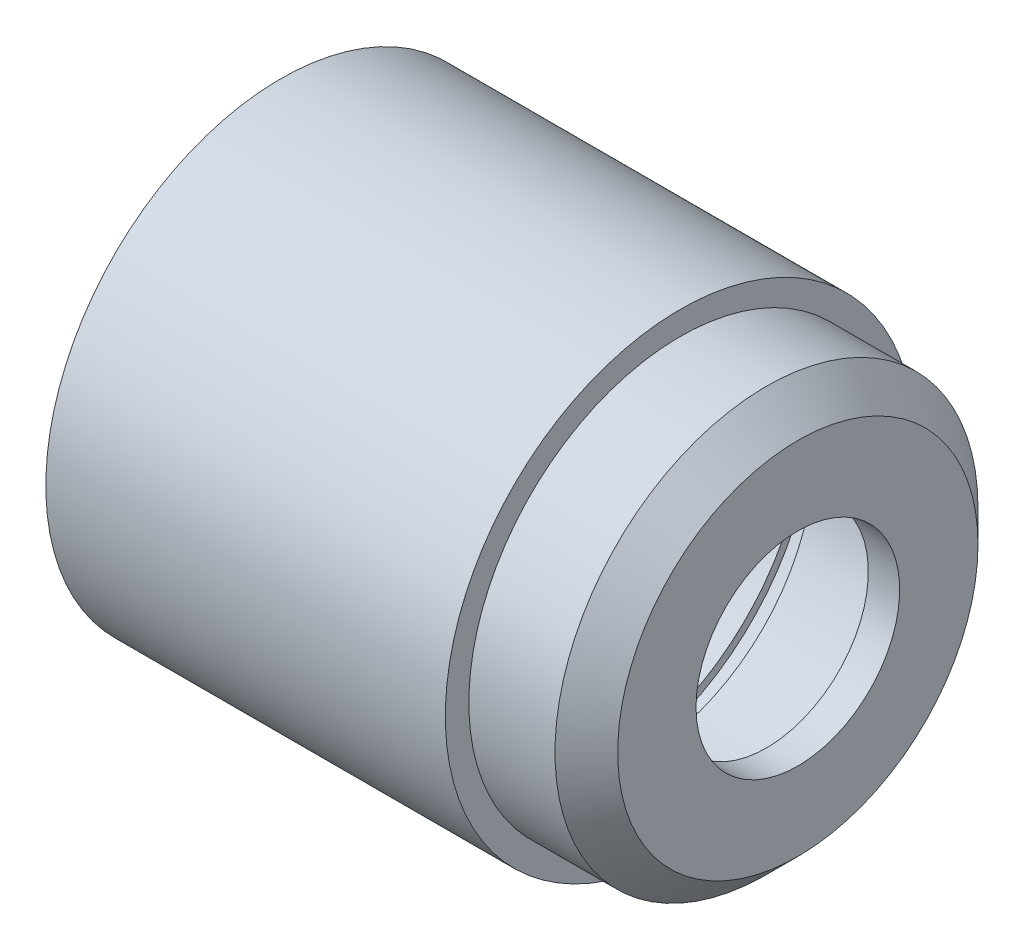
from build123d import *

# Parameters (mm, degrees)
SKETCH1_R           = 15
BOSS_EXTRUDE1_DEPTH = 25.5
SKETCH2_R           = 13.5
BOSS_EXTRUDE2_DEPTH = 7.5
SKETCH3_R           = 14
CUT_EXTRUDE1_DEPTH  = 6.5
SKETCH4_R           = 13
CUT_EXTRUDE2_DEPTH  = 14
SKETCH5_R           = 13.5
CUT_EXTRUDE3_DEPTH  = 2.5
SKETCH6_R           = 11
CUT_EXTRUDE4_DEPTH  = 6
SKETCH7_R           = 11.5
CUT_EXTRUDE5_DEPTH  = 1
SKETCH9_R           = 10
CUT_EXTRUDE6_DEPTH  = 1
SKETCH10_R          = 6.5
CUT_EXTRUDE7_DEPTH  = 2
CHAMFER1_SIZE       = 2


with BuildPart() as part:
    # Sketch1 → Boss-Extrude1 (new body)
    with BuildSketch(Plane(origin=(0, 0, 0), x_dir=(0, 0, -1), z_dir=(1, 0, 0))):
        Circle(SKETCH1_R)
    extrude(amount=BOSS_EXTRUDE1_DEPTH)

    # Sketch2 → Boss-Extrude2 (add)
    with BuildSketch(Plane(origin=(25.5, 0, 0), x_dir=(0, 0, -1), z_dir=(1, 0, 0))):
        Circle(SKETCH2_R)
    extrude(amount=BOSS_EXTRUDE2_DEPTH)

    # Sketch3 → Cut-Extrude1 (cut)
    with BuildSketch(Plane.ZY):
        Circle(SKETCH3_R)
    extrude(amount=-CUT_EXTRUDE1_DEPTH, mode=Mode.SUBTRACT)

    # Sketch4 → Cut-Extrude2 (cut)
    with BuildSketch(Plane.ZY.offset(-6.5)):
        Circle(SKETCH4_R)
    extrude(amount=-CUT_EXTRUDE2_DEPTH, mode=Mode.SUBTRACT)

    # Sketch5 → Cut-Extrude3 (cut)
    with BuildSketch(Plane.ZY.offset(-20.5)):
        Circle(SKETCH5_R)
    extrude(amount=-CUT_EXTRUDE3_DEPTH, mode=Mode.SUBTRACT)

    # Sketch6 → Cut-Extrude4 (cut)
    with BuildSketch(Plane.ZY.offset(-23)):
        Circle(SKETCH6_R)
    extrude(amount=-CUT_EXTRUDE4_DEPTH, mode=Mode.SUBTRACT)

    # Sketch7 → Cut-Extrude5 (cut)
    with BuildSketch(Plane.ZY.offset(-29)):
        Circle(SKETCH7_R)
    extrude(amount=-CUT_EXTRUDE5_DEPTH, mode=Mode.SUBTRACT)

    # Sketch9 → Cut-Extrude6 (cut)
    with BuildSketch(Plane.ZY.offset(-30)):
        Circle(SKETCH9_R)
    extrude(amount=-CUT_EXTRUDE6_DEPTH, mode=Mode.SUBTRACT)

    # Sketch10 → Cut-Extrude7 (cut)
    with BuildSketch(Plane.ZY.offset(-31)):
        Circle(SKETCH10_R)
    extrude(amount=-CUT_EXTRUDE7_DEPTH, mode=Mode.SUBTRACT)

    # Chamfer1
    chamfer1_edges = [part.edges().sort_by_distance(p)[0] for p in [
        (33, 0, 13.5),
    ]]
    chamfer(chamfer1_edges, length=CHAMFER1_SIZE)


solid = part.part
